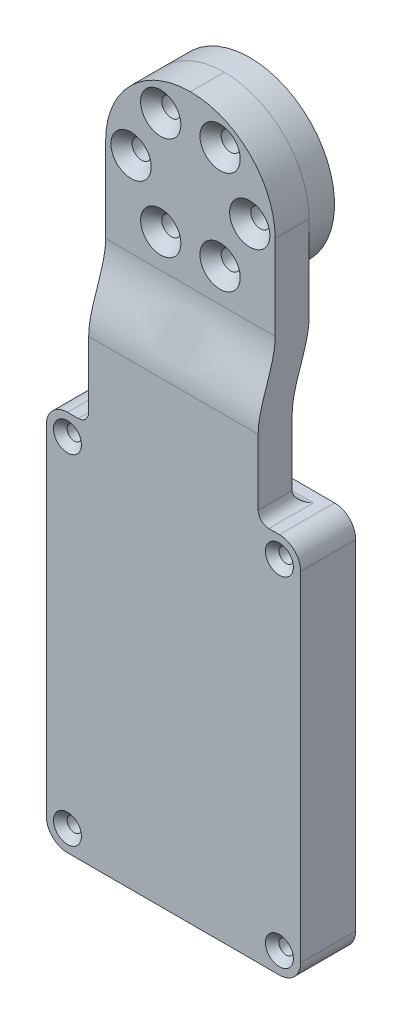
from build123d import *

# Parameters (mm, degrees)
SKETCH7_W           = 40
SKETCH7_H           = 40
BOSS_EXTRUDE1_DEPTH = 14
LOFT1_START         = -20
LOFT1_DEPTH         = 40
SKETCH16_W          = 49.026286786
SKETCH16_H          = 65.242270374
SKETCH16_R          = 20
CUT_EXTRUDE3_DEPTH  = 6
SKETCH17_W          = 40
SKETCH17_H          = 8
BOSS_EXTRUDE5_DEPTH = 18
SKETCH10_R          = 2.25
CUT_EXTRUDE1_DEPTH  = 25
CHAMFER1_SIZE       = 2.5
FILLET3_R           = 20
SKETCH11_W          = 60
SKETCH11_H          = 18
BOSS_EXTRUDE6_DEPTH = 90
FILLET9_R           = 2.5
SKETCH20_W          = 50
SKETCH20_H          = 8
CUT_EXTRUDE4_DEPTH  = 80
SKETCH28_W          = 15
SKETCH28_H          = 8
BOSS_EXTRUDE7_DEPTH = 10
FILLET13_R          = 4
SKETCH37_W          = 60
SKETCH37_H          = 90
CUT_EXTRUDE8_DEPTH  = 5
FILLET16_R          = 5
SKETCH38_R          = 1.7
CUT_EXTRUDE9_DEPTH  = 22
CHAMFER3_SIZE       = 1.6


# Read off the part's stored shape, not the designer's step: Loft1
with BuildPart() as part:
    # Sketch7 → Boss-Extrude1 (new body)
    with BuildSketch(Plane.XY):
        Rectangle(SKETCH7_W, SKETCH7_H)
    extrude(amount=BOSS_EXTRUDE1_DEPTH)

    # Loft1 outline → Loft1 (add)
    with BuildSketch(Plane.YZ.offset(LOFT1_START)):
        with BuildLine():
            add(Edge.make_bspline(
                [(-38, 18), (-31.853637028, 18), (-26.146362972, 14), (-20, 14)],
                knots=[0, 0, 0, 0, 1, 1, 1, 1], degree=3))
            Line((-38, 18), (-38, 10))
            add(Edge.make_bspline(
                [(-38, 10), (-31.853637028, 10), (-26.146362972, 6), (-20, 6)],
                knots=[0, 0, 0, 0, 1, 1, 1, 1], degree=3))
            Line((-20, 6), (-20, 14))
        make_face()
    extrude(amount=LOFT1_DEPTH)

    # Sketch16 → Cut-Extrude3 (cut)
    with BuildSketch(Plane(origin=(0, 0, 0), x_dir=(-1, 0, 0), z_dir=(0, 0, -1))):
        Rectangle(SKETCH16_W, SKETCH16_H)
        Circle(SKETCH16_R, mode=Mode.SUBTRACT)
    extrude(amount=-CUT_EXTRUDE3_DEPTH, mode=Mode.SUBTRACT)

    # Sketch17 → Boss-Extrude5 (add)
    with BuildSketch(Plane(origin=(0, -38, 0), x_dir=(-1, 0, 0), z_dir=(0, -1, 0))):
        with Locations((0, -14)):
            Rectangle(SKETCH17_W, SKETCH17_H)
    extrude(amount=BOSS_EXTRUDE5_DEPTH)

    # Sketch10 → Cut-Extrude1 (cut)
    with BuildSketch(Plane.XY.offset(14)):
        with Locations((-7.00009521, 12.124420806)):
            Circle(SKETCH10_R)
        with Locations((6.99990479, 12.124420806)):
            Circle(SKETCH10_R)
        with Locations((13.99990479, 6.5153e-05)):
            Circle(SKETCH10_R)
        with Locations((6.99990479, -12.1242905)):
            Circle(SKETCH10_R)
        with Locations((-7.00009521, -12.1242905)):
            Circle(SKETCH10_R)
        with Locations((-14.00009521, 6.5153e-05)):
            Circle(SKETCH10_R)
    extrude(amount=-CUT_EXTRUDE1_DEPTH, mode=Mode.SUBTRACT)

    # Chamfer1
    chamfer1_edges = [part.edges().sort_by_distance(p)[0] for p in [
        (4.74990479, 12.124420806, 14),
        (-9.25009521, 12.124420806, 14),
        (-16.25009521, 6.5153e-05, 14),
        (-9.25009521, -12.1242905, 14),
        (4.74990479, -12.1242905, 14),
        (11.74990479, 6.5153e-05, 14),
    ]]
    chamfer(chamfer1_edges, length=CHAMFER1_SIZE)

    # Fillet3
    fillet3_edges = [part.edges().sort_by_distance(p)[0] for p in [
        (20, 20, 10),
        (-20, 20, 10),
    ]]
    fillet(fillet3_edges, radius=FILLET3_R - 0.0001)  # a hair under: the kernel refuses the full size

    # Sketch11 → Boss-Extrude6 (add)
    with BuildSketch(Plane(origin=(0, -56, -3.472963553), x_dir=(1, 0, 0), z_dir=(0, 1, 0))):
        with Locations((0, -12.472963553)):
            Rectangle(SKETCH11_W, SKETCH11_H)
    extrude(amount=-BOSS_EXTRUDE6_DEPTH)

    # Fillet9
    fillet9_edges = [part.edges().sort_by_distance(p)[0] for p in [
        (0, -56, 10),
        (-20, -56, 14),
        (20, -56, 14),
    ]]
    fillet(fillet9_edges, radius=FILLET9_R)

    # Sketch20 → Cut-Extrude4 (cut)
    with BuildSketch(Plane.XZ.offset(146)):
        with Locations((0, 9)):
            Rectangle(SKETCH20_W, SKETCH20_H)
    extrude(amount=-CUT_EXTRUDE4_DEPTH, mode=Mode.SUBTRACT)

    # Sketch28 → Boss-Extrude7 (add)
    with BuildSketch(Plane(origin=(0, -146, 0), x_dir=(-1, 0, 0), z_dir=(0, -1, 0))):
        with Locations((17.5, -9)):
            Rectangle(SKETCH28_W, SKETCH28_H)
        with Locations((-17.5, -9)):
            Rectangle(SKETCH28_W, SKETCH28_H)
    extrude(amount=-BOSS_EXTRUDE7_DEPTH)

    # Fillet13
    fillet13_edges = [part.edges().sort_by_distance(p)[0] for p in [
        (-25, -66, 9),
        (25, -66, 9),
        (-25, -136, 9),
        (-10, -136, 9),
        (10, -136, 9),
        (25, -136, 9),
    ]]
    fillet(fillet13_edges, radius=FILLET13_R)

    # Sketch37 → Cut-Extrude8 (cut)
    with BuildSketch(Plane.XY):
        with Locations((0, -101)):
            Rectangle(SKETCH37_W, SKETCH37_H)
    extrude(amount=CUT_EXTRUDE8_DEPTH, mode=Mode.SUBTRACT)

    # Fillet16
    fillet16_edges = [part.edges().sort_by_distance(p)[0] for p in [
        (30, -56, 11.5),
        (30, -146, 11.5),
        (-30, -146, 11.5),
        (-30, -56, 11.5),
    ]]
    fillet(fillet16_edges, radius=FILLET16_R)

    # Sketch38 → Cut-Extrude9 (cut)
    with BuildSketch(Plane.XY):
        with Locations(Location((25, -61, 0), (0, 0, 180))):
            Circle(SKETCH38_R)
        with Locations(Location((-25, -61, 0), (0, 0, 180))):
            Circle(SKETCH38_R)
        with Locations(Location((-25, -141, 0), (0, 0, 180))):
            Circle(SKETCH38_R)
        with Locations(Location((25, -141, 0), (0, 0, 180))):
            Circle(SKETCH38_R)
    extrude(amount=CUT_EXTRUDE9_DEPTH, mode=Mode.SUBTRACT)

    # Chamfer3
    chamfer3_edges = [part.edges().sort_by_distance(p)[0] for p in [
        (26.7, -141, 18),
        (-23.3, -141, 18),
        (-23.3, -61, 18),
        (26.7, -61, 18),
    ]]
    chamfer(chamfer3_edges, length=CHAMFER3_SIZE)


solid = part.part
